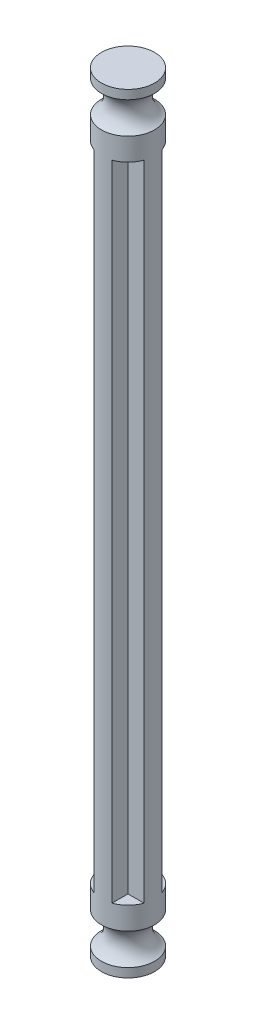
from build123d import *
from build123d.topology import SkipClean

# Parameters (mm, degrees)
EXTRUDE_2_DEPTH = 71.42


with BuildPart() as part:
    # 草图1 → 凸台-拉伸2 (new body)
    with BuildSketch(Plane(origin=(0, 0, 0), x_dir=(1, 0, 0), z_dir=(0, 1, 0))):
        with BuildLine():
            Line((1, 1), (1, 2.775337817))
            ThreePointArc((1, 2.775337817), (0, 2.95), (-1, 2.775337817))
            Line((-1, 2.775337817), (-1, 1))
            Line((-1, 1), (-2.775337817, 1))
            ThreePointArc((-2.775337817, 1), (-2.95, 0), (-2.775337817, -1))
            Line((-2.775337817, -1), (-1, -1))
            Line((-1, -1), (-1, -2.775337817))
            ThreePointArc((-1, -2.775337817), (0, -2.95), (1, -2.775337817))
            Line((1, -2.775337817), (1, -1))
            Line((1, -1), (2.775337817, -1))
            ThreePointArc((2.775337817, -1), (2.95, 0), (2.775337817, 1))
            Line((2.775337817, 1), (1, 1))
        make_face()
    extrude(amount=EXTRUDE_2_DEPTH)

    # 草图3 → 旋转3 (revolve)
    with SkipClean():  # the faces are left unmerged after this step: merging them gives an invalid solid
        with BuildSketch(Plane(origin=(0, 0, 0), x_dir=(0, 0, -1), z_dir=(1, 0, 0))):
            with BuildLine():
                Line((0, 71.42), (0, 78.42))
                Line((0, 78.42), (2.95, 78.42))
                Line((2.95, 78.42), (2.95, 77.42))
                ThreePointArc((2.95, 77.42), (1.918245837, 75.67), (2.95, 73.92))
                Line((2.95, 73.92), (2.95, 71.42))
                Line((2.95, 71.42), (0, 71.42))
            make_face()
            with BuildLine():
                Line((0, 0), (0, -7))
                Line((0, -7), (2.95, -7))
                Line((2.95, -7), (2.95, -6))
                ThreePointArc((2.95, -6), (1.918245837, -4.25), (2.95, -2.5))
                Line((2.95, -2.5), (2.95, 0))
                Line((2.95, 0), (0, 0))
            make_face()
        revolve(axis=Axis((0, 0, 0), (0, -1, 0)))


solid = part.part
